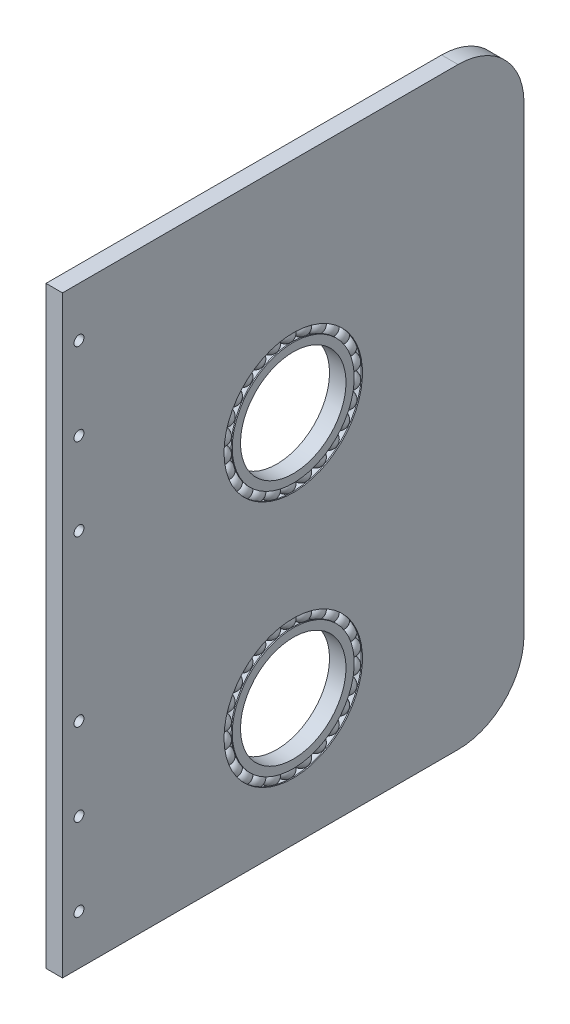
from build123d import *

# Parameters (mm, degrees)
SKETCH1_W             = 140
SKETCH1_H             = 180
BOSS_EXTRUDE1_DEPTH   = 5
FILLET3_R             = 20
SKETCH18_R            = 23.5
CUT_EXTRUDE4_DEPTH    = 115.127122105
F_3_0MM_DOWEL_HOLE1_D = 3
CIRPATTERN2_COUNT     = 26


with BuildPart() as part:
    # Sketch1 → Boss-Extrude1 (new body)
    with BuildSketch(Plane(origin=(0, 0, 0), x_dir=(0, 0, -1), z_dir=(1, 0, 0))):
        Rectangle(SKETCH1_W, SKETCH1_H)
    extrude(amount=BOSS_EXTRUDE1_DEPTH)

    # Fillet3
    fillet3_edges = [part.edges().sort_by_distance(p)[0] for p in [
        (2.5, 90, -70),
        (2.5, -90, -70),
    ]]
    fillet(fillet3_edges, radius=FILLET3_R)

    # Sketch18 → Cut-Extrude4 (cut, through all)
    with BuildSketch(Plane(origin=(5, 0, 0), x_dir=(0, 0, -1), z_dir=(1, 0, 0))):
        with Locations((0, 23.5)):
            Circle(SKETCH18_R)
        with Locations((0, -51.5)):
            Circle(SKETCH18_R)
    extrude(amount=-CUT_EXTRUDE4_DEPTH, mode=Mode.SUBTRACT)

    # Ø3.0mm Dowel Hole1 (through all)
    with Locations(Plane(origin=(5, 0, 0), x_dir=(0, 0, -1), z_dir=(1, 0, 0))):
        with Locations((-65, -75), (-65, -50), (-65, -25), (-65, 25), (-65, 50), (-65, 75)):
            Hole(F_3_0MM_DOWEL_HOLE1_D / 2)


with BuildPart() as body_2:
    # Sketch19 → Revolve1 (revolve)
    with BuildSketch(Plane.XY, mode=Mode.PRIVATE) as revolve1_sk:
        with BuildLine():
            Line((5, 47), (0, 47))
            Line((0, 47), (0, 44.5))
            Line((0, 44.5), (0.334936491, 44.5))
            ThreePointArc((0.334936491, 44.5), (2.5, 45.75), (4.665063509, 44.5))
            Line((4.665063509, 44.5), (5, 44.5))
            Line((5, 44.5), (5, 47))
        make_face()
        with BuildLine():
            Line((5, 39.5), (0, 39.5))
            Line((0, 39.5), (0, 42))
            Line((0, 42), (0.334936491, 42))
            ThreePointArc((0.334936491, 42), (2.5, 40.75), (4.665063509, 42))
            Line((4.665063509, 42), (5, 42))
            Line((5, 42), (5, 39.5))
        make_face()
    revolve(revolve1_sk.sketch.rotate(Axis((5.915063509, 23.5, 0), (1, 0, 0)), 90), axis=Axis((5.915063509, 23.5, 0), (1, 0, 0)))


with BuildPart() as body_3:
    # Sketch20 → Revolve2 (revolve)
    with BuildSketch(Plane.XY):
        with BuildLine():
            Line((4.89, 43.25), (0.11, 43.25))
            ThreePointArc((0.11, 43.25), (2.5, 40.86), (4.89, 43.25))
        make_face()
    revolve(axis=Axis((6.375608652, 43.25, 0), (-1, 0, 0)))


with BuildPart() as cirpattern2_1:
    # CirPattern2: pattern copy
    add(body_3.part.rotate(Axis((0, 23.5, 0), (1, 0, 0)), 1 * 360 / CIRPATTERN2_COUNT))


with BuildPart() as cirpattern2_2:
    # CirPattern2: pattern copy
    add(body_3.part.rotate(Axis((0, 23.5, 0), (1, 0, 0)), 2 * 360 / CIRPATTERN2_COUNT))


with BuildPart() as cirpattern2_3:
    # CirPattern2: pattern copy
    add(body_3.part.rotate(Axis((0, 23.5, 0), (1, 0, 0)), 3 * 360 / CIRPATTERN2_COUNT))


with BuildPart() as cirpattern2_4:
    # CirPattern2: pattern copy
    add(body_3.part.rotate(Axis((0, 23.5, 0), (1, 0, 0)), 4 * 360 / CIRPATTERN2_COUNT))


with BuildPart() as cirpattern2_5:
    # CirPattern2: pattern copy
    add(body_3.part.rotate(Axis((0, 23.5, 0), (1, 0, 0)), 5 * 360 / CIRPATTERN2_COUNT))


with BuildPart() as cirpattern2_6:
    # CirPattern2: pattern copy
    add(body_3.part.rotate(Axis((0, 23.5, 0), (1, 0, 0)), 6 * 360 / CIRPATTERN2_COUNT))


with BuildPart() as cirpattern2_7:
    # CirPattern2: pattern copy
    add(body_3.part.rotate(Axis((0, 23.5, 0), (1, 0, 0)), 7 * 360 / CIRPATTERN2_COUNT))


with BuildPart() as cirpattern2_8:
    # CirPattern2: pattern copy
    add(body_3.part.rotate(Axis((0, 23.5, 0), (1, 0, 0)), 8 * 360 / CIRPATTERN2_COUNT))


with BuildPart() as cirpattern2_9:
    # CirPattern2: pattern copy
    add(body_3.part.rotate(Axis((0, 23.5, 0), (1, 0, 0)), 9 * 360 / CIRPATTERN2_COUNT))


with BuildPart() as cirpattern2_10:
    # CirPattern2: pattern copy
    add(body_3.part.rotate(Axis((0, 23.5, 0), (1, 0, 0)), 10 * 360 / CIRPATTERN2_COUNT))


with BuildPart() as cirpattern2_11:
    # CirPattern2: pattern copy
    add(body_3.part.rotate(Axis((0, 23.5, 0), (1, 0, 0)), 11 * 360 / CIRPATTERN2_COUNT))


with BuildPart() as cirpattern2_12:
    # CirPattern2: pattern copy
    add(body_3.part.rotate(Axis((0, 23.5, 0), (1, 0, 0)), 12 * 360 / CIRPATTERN2_COUNT))


with BuildPart() as cirpattern2_13:
    # CirPattern2: pattern copy
    add(body_3.part.rotate(Axis((0, 23.5, 0), (1, 0, 0)), 13 * 360 / CIRPATTERN2_COUNT))


with BuildPart() as cirpattern2_14:
    # CirPattern2: pattern copy
    add(body_3.part.rotate(Axis((0, 23.5, 0), (1, 0, 0)), 14 * 360 / CIRPATTERN2_COUNT))


with BuildPart() as cirpattern2_15:
    # CirPattern2: pattern copy
    add(body_3.part.rotate(Axis((0, 23.5, 0), (1, 0, 0)), 15 * 360 / CIRPATTERN2_COUNT))


with BuildPart() as cirpattern2_16:
    # CirPattern2: pattern copy
    add(body_3.part.rotate(Axis((0, 23.5, 0), (1, 0, 0)), 16 * 360 / CIRPATTERN2_COUNT))


with BuildPart() as cirpattern2_17:
    # CirPattern2: pattern copy
    add(body_3.part.rotate(Axis((0, 23.5, 0), (1, 0, 0)), 17 * 360 / CIRPATTERN2_COUNT))


with BuildPart() as cirpattern2_18:
    # CirPattern2: pattern copy
    add(body_3.part.rotate(Axis((0, 23.5, 0), (1, 0, 0)), 18 * 360 / CIRPATTERN2_COUNT))


with BuildPart() as cirpattern2_19:
    # CirPattern2: pattern copy
    add(body_3.part.rotate(Axis((0, 23.5, 0), (1, 0, 0)), 19 * 360 / CIRPATTERN2_COUNT))


with BuildPart() as cirpattern2_20:
    # CirPattern2: pattern copy
    add(body_3.part.rotate(Axis((0, 23.5, 0), (1, 0, 0)), 20 * 360 / CIRPATTERN2_COUNT))


with BuildPart() as cirpattern2_21:
    # CirPattern2: pattern copy
    add(body_3.part.rotate(Axis((0, 23.5, 0), (1, 0, 0)), 21 * 360 / CIRPATTERN2_COUNT))


with BuildPart() as cirpattern2_22:
    # CirPattern2: pattern copy
    add(body_3.part.rotate(Axis((0, 23.5, 0), (1, 0, 0)), 22 * 360 / CIRPATTERN2_COUNT))


with BuildPart() as cirpattern2_23:
    # CirPattern2: pattern copy
    add(body_3.part.rotate(Axis((0, 23.5, 0), (1, 0, 0)), 23 * 360 / CIRPATTERN2_COUNT))


with BuildPart() as cirpattern2_24:
    # CirPattern2: pattern copy
    add(body_3.part.rotate(Axis((0, 23.5, 0), (1, 0, 0)), 24 * 360 / CIRPATTERN2_COUNT))


with BuildPart() as cirpattern2_25:
    # CirPattern2: pattern copy
    add(body_3.part.rotate(Axis((0, 23.5, 0), (1, 0, 0)), 25 * 360 / CIRPATTERN2_COUNT))


with BuildPart() as body_29:
    # Mirror4: mirrored copy
    add(body_2.part.mirror(Plane.ZX.offset(-14)))


with BuildPart() as body_30:
    # Mirror4 2: mirrored copy
    add(body_3.part.mirror(Plane.ZX.offset(-14)))


with BuildPart() as body_31:
    # Mirror4 3: mirrored copy
    add(cirpattern2_1.part.mirror(Plane.ZX.offset(-14)))


with BuildPart() as body_32:
    # Mirror4 4: mirrored copy
    add(cirpattern2_2.part.mirror(Plane.ZX.offset(-14)))


with BuildPart() as body_33:
    # Mirror4 5: mirrored copy
    add(cirpattern2_3.part.mirror(Plane.ZX.offset(-14)))


with BuildPart() as body_34:
    # Mirror4 6: mirrored copy
    add(cirpattern2_4.part.mirror(Plane.ZX.offset(-14)))


with BuildPart() as body_35:
    # Mirror4 7: mirrored copy
    add(cirpattern2_5.part.mirror(Plane.ZX.offset(-14)))


with BuildPart() as body_36:
    # Mirror4 8: mirrored copy
    add(cirpattern2_6.part.mirror(Plane.ZX.offset(-14)))


with BuildPart() as body_37:
    # Mirror4 9: mirrored copy
    add(cirpattern2_7.part.mirror(Plane.ZX.offset(-14)))


with BuildPart() as body_38:
    # Mirror4 10: mirrored copy
    add(cirpattern2_8.part.mirror(Plane.ZX.offset(-14)))


with BuildPart() as body_39:
    # Mirror4 11: mirrored copy
    add(cirpattern2_9.part.mirror(Plane.ZX.offset(-14)))


with BuildPart() as body_40:
    # Mirror4 12: mirrored copy
    add(cirpattern2_10.part.mirror(Plane.ZX.offset(-14)))


with BuildPart() as body_41:
    # Mirror4 13: mirrored copy
    add(cirpattern2_11.part.mirror(Plane.ZX.offset(-14)))


with BuildPart() as body_42:
    # Mirror4 14: mirrored copy
    add(cirpattern2_12.part.mirror(Plane.ZX.offset(-14)))


with BuildPart() as body_43:
    # Mirror4 15: mirrored copy
    add(cirpattern2_13.part.mirror(Plane.ZX.offset(-14)))


with BuildPart() as body_44:
    # Mirror4 16: mirrored copy
    add(cirpattern2_14.part.mirror(Plane.ZX.offset(-14)))


with BuildPart() as body_45:
    # Mirror4 17: mirrored copy
    add(cirpattern2_15.part.mirror(Plane.ZX.offset(-14)))


with BuildPart() as body_46:
    # Mirror4 18: mirrored copy
    add(cirpattern2_16.part.mirror(Plane.ZX.offset(-14)))


with BuildPart() as body_47:
    # Mirror4 19: mirrored copy
    add(cirpattern2_17.part.mirror(Plane.ZX.offset(-14)))


with BuildPart() as body_48:
    # Mirror4 20: mirrored copy
    add(cirpattern2_18.part.mirror(Plane.ZX.offset(-14)))


with BuildPart() as body_49:
    # Mirror4 21: mirrored copy
    add(cirpattern2_19.part.mirror(Plane.ZX.offset(-14)))


with BuildPart() as body_50:
    # Mirror4 22: mirrored copy
    add(cirpattern2_20.part.mirror(Plane.ZX.offset(-14)))


with BuildPart() as body_51:
    # Mirror4 23: mirrored copy
    add(cirpattern2_21.part.mirror(Plane.ZX.offset(-14)))


with BuildPart() as body_52:
    # Mirror4 24: mirrored copy
    add(cirpattern2_22.part.mirror(Plane.ZX.offset(-14)))


with BuildPart() as body_53:
    # Mirror4 25: mirrored copy
    add(cirpattern2_23.part.mirror(Plane.ZX.offset(-14)))


with BuildPart() as body_54:
    # Mirror4 26: mirrored copy
    add(cirpattern2_24.part.mirror(Plane.ZX.offset(-14)))


with BuildPart() as body_55:
    # Mirror4 27: mirrored copy
    add(cirpattern2_25.part.mirror(Plane.ZX.offset(-14)))


with BuildPart() as part_1:
    add(part.part)

    # Intersect1: read off the stored shape, not the designer's step
    # Intersect1: union body 29, body 2
    add(body_29.part)
    add(body_2.part)


solid = Compound([body_3.part, cirpattern2_1.part, cirpattern2_2.part, cirpattern2_3.part, cirpattern2_4.part, cirpattern2_5.part, cirpattern2_6.part, cirpattern2_7.part, cirpattern2_8.part, cirpattern2_9.part, cirpattern2_10.part, cirpattern2_11.part, cirpattern2_12.part, cirpattern2_13.part, cirpattern2_14.part, cirpattern2_15.part, cirpattern2_16.part, cirpattern2_17.part, cirpattern2_18.part, cirpattern2_19.part, cirpattern2_20.part, cirpattern2_21.part, cirpattern2_22.part, cirpattern2_23.part, cirpattern2_24.part, cirpattern2_25.part, body_30.part, body_31.part, body_32.part, body_33.part, body_34.part, body_35.part, body_36.part, body_37.part, body_38.part, body_39.part, body_40.part, body_41.part, body_42.part, body_43.part, body_44.part, body_45.part, body_46.part, body_47.part, body_48.part, body_49.part, body_50.part, body_51.part, body_52.part, body_53.part, body_54.part, body_55.part, part_1.part])
